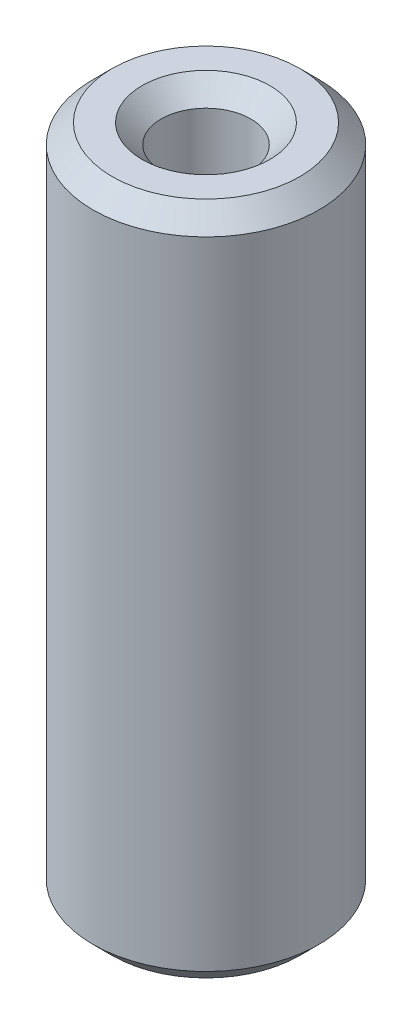
from build123d import *

# Parameters (mm, degrees)
SKETCH1_R           = 20
BOSS_EXTRUDE1_DEPTH = 119.429175792
SKETCH2_R           = 7.926829013
CUT_EXTRUDE1_DEPTH  = 123.732750439
CHAMFER1_SIZE       = 3.399394859


with BuildPart() as part:
    # Sketch1 → Boss-Extrude1 (new body)
    with BuildSketch(Plane(origin=(0, 0, 0), x_dir=(1, 0, 0), z_dir=(0, 1, 0))):
        Circle(SKETCH1_R)
    extrude(amount=BOSS_EXTRUDE1_DEPTH)

    # Sketch2 → Cut-Extrude1 (cut, through all)
    with BuildSketch(Plane(origin=(0, 0, 0), x_dir=(1, 0, 0), z_dir=(0, 1, 0))):
        Circle(SKETCH2_R)
    extrude(amount=CUT_EXTRUDE1_DEPTH, mode=Mode.SUBTRACT)

    # Chamfer1
    chamfer1_edges = [part.edges().sort_by_distance(p)[0] for p in [
        (-7.926829013, 119.429175792, 0),
        (-7.926829013, 0, 0),
        (-20, 0, 0),
        (-20, 119.429175792, 0),
    ]]
    chamfer(chamfer1_edges, length=CHAMFER1_SIZE)


solid = part.part
